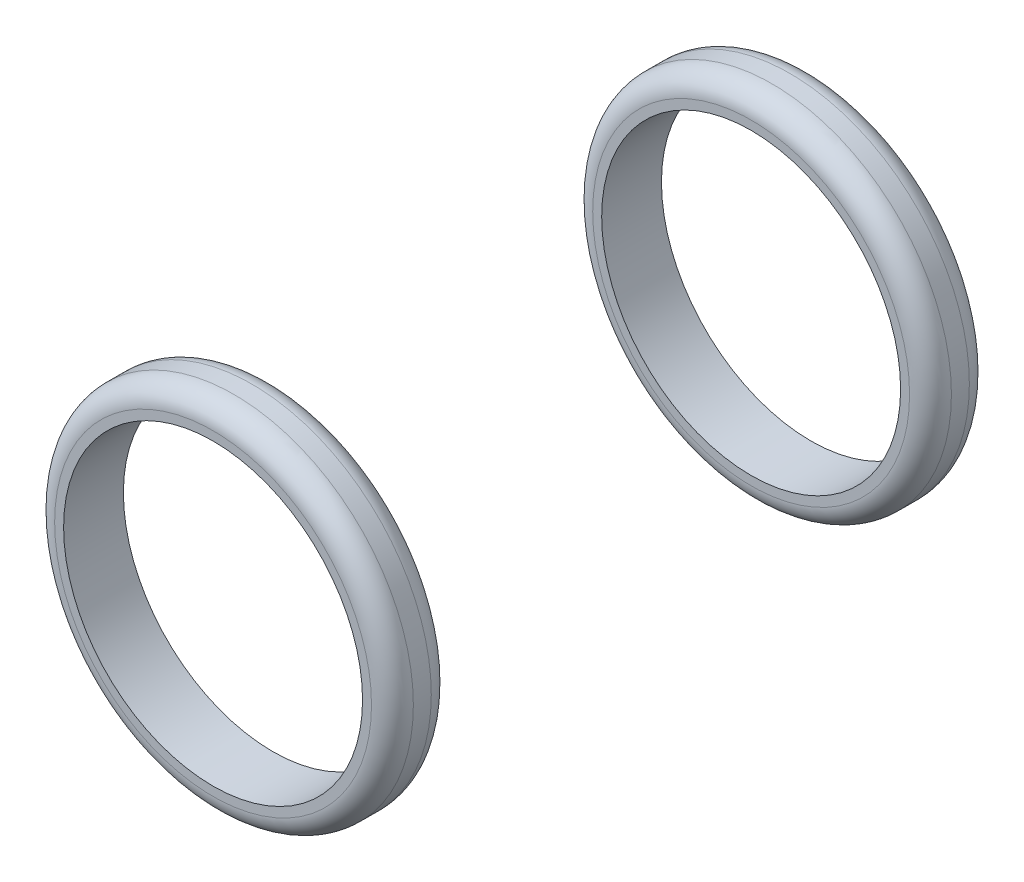
from build123d import *

# Parameters (mm, degrees)
BOSS_EXTRUDE1_START     = -100
BOSS_EXTRUDE1_OUTLINE_R = 300
BOSS_EXTRUDE1_DEPTH     = 100
FILLET3_R               = 35
SKETCH5_R               = 250
CUT_EXTRUDE1_DEPTH      = 100
SKETCH13_R              = 300
BOSS_EXTRUDE11_DEPTH    = 100
FILLET4_R               = 35
CUT_EXTRUDE2_START      = -100
SKETCH14_R              = 250
CUT_EXTRUDE2_DEPTH      = 100


# Read off the part's stored shape, not the designer's step: Boss-Extrude1
with BuildPart() as part:
    # Boss-Extrude1 outline → Boss-Extrude1 (new body)
    with BuildSketch(Plane.XY.offset(-400).offset(BOSS_EXTRUDE1_START)):
        with Locations((0, -600)):
            Circle(BOSS_EXTRUDE1_OUTLINE_R)
    extrude(amount=BOSS_EXTRUDE1_DEPTH)

    # Fillet3
    fillet3_edges = [part.edges().sort_by_distance(p)[0] for p in [
        (-300, -600, -400),
        (-300, -600, -500),
    ]]
    fillet(fillet3_edges, radius=FILLET3_R)

    # Sketch5 → Cut-Extrude1 (cut)
    with BuildSketch(Plane(origin=(0, 0, -500), x_dir=(-1, 0, 0), z_dir=(0, 0, -1))):
        with Locations((0, -600)):
            Circle(SKETCH5_R)
    extrude(amount=-CUT_EXTRUDE1_DEPTH, mode=Mode.SUBTRACT)


with BuildPart() as body_2:
    # Sketch13 → Boss-Extrude11 (new body)
    with BuildSketch(Plane.XY.offset(400)):
        with Locations((0, -600)):
            Circle(SKETCH13_R)
    extrude(amount=BOSS_EXTRUDE11_DEPTH)

    # Fillet4
    fillet4_edges = [body_2.edges().sort_by_distance(p)[0] for p in [
        (-300, -600, 400),
        (-300, -600, 500),
    ]]
    fillet(fillet4_edges, radius=FILLET4_R)

    # Sketch14 → Cut-Extrude2 (cut)
    with BuildSketch(Plane.XY.offset(500).offset(CUT_EXTRUDE2_START)):
        with Locations((0, -600)):
            Circle(SKETCH14_R)
    extrude(amount=CUT_EXTRUDE2_DEPTH, mode=Mode.SUBTRACT)


solid = Compound([part.part, body_2.part])
